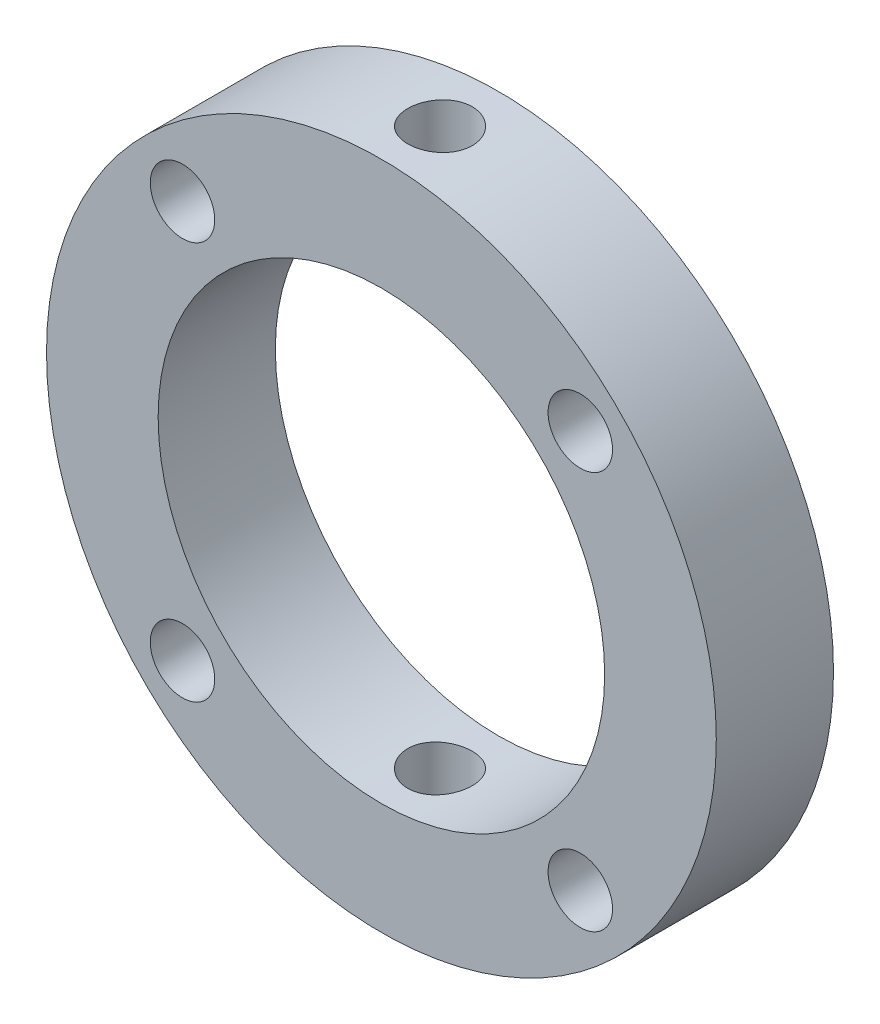
from build123d import *

# Parameters (mm, degrees)
SKETCH1_R           = 28.575
BOSS_EXTRUDE1_DEPTH = 10
SKETCH2_R           = 19.05
CUT_EXTRUDE1_DEPTH  = 42.630052246
SKETCH5_R           = 2.75
CUT_EXTRUDE2_DEPTH  = 65.673434461
SKETCH6_R           = 2.75
CUT_EXTRUDE3_DEPTH  = 42.630052407


with BuildPart() as part:
    # Sketch1 → Boss-Extrude1 (new body)
    with BuildSketch(Plane.XY):
        Circle(SKETCH1_R)
    extrude(amount=BOSS_EXTRUDE1_DEPTH)

    # Sketch2 → Cut-Extrude1 (cut, through all)
    with BuildSketch(Plane.XY.offset(10)):
        Circle(SKETCH2_R)
    extrude(amount=-CUT_EXTRUDE1_DEPTH, mode=Mode.SUBTRACT)

    # Sketch5 → Cut-Extrude2 (cut, through all)
    with BuildSketch(Plane(origin=(0, 28.575, 0), x_dir=(1, 0, 0), z_dir=(0, 1, 0))):
        with Locations((0, -5)):
            Circle(SKETCH5_R)
    extrude(amount=-CUT_EXTRUDE2_DEPTH, mode=Mode.SUBTRACT)

    # Sketch6 → Cut-Extrude3 (cut, through all)
    with BuildSketch(Plane.XY.offset(10)):
        with Locations((-16.970562748, 16.970562748)):
            Circle(SKETCH6_R)
        with Locations((16.970562748, 16.970562748)):
            Circle(SKETCH6_R)
        with Locations((16.970562748, -16.970562748)):
            Circle(SKETCH6_R)
        with Locations((-16.970562748, -16.970562748)):
            Circle(SKETCH6_R)
    extrude(amount=-CUT_EXTRUDE3_DEPTH, mode=Mode.SUBTRACT)


solid = part.part
